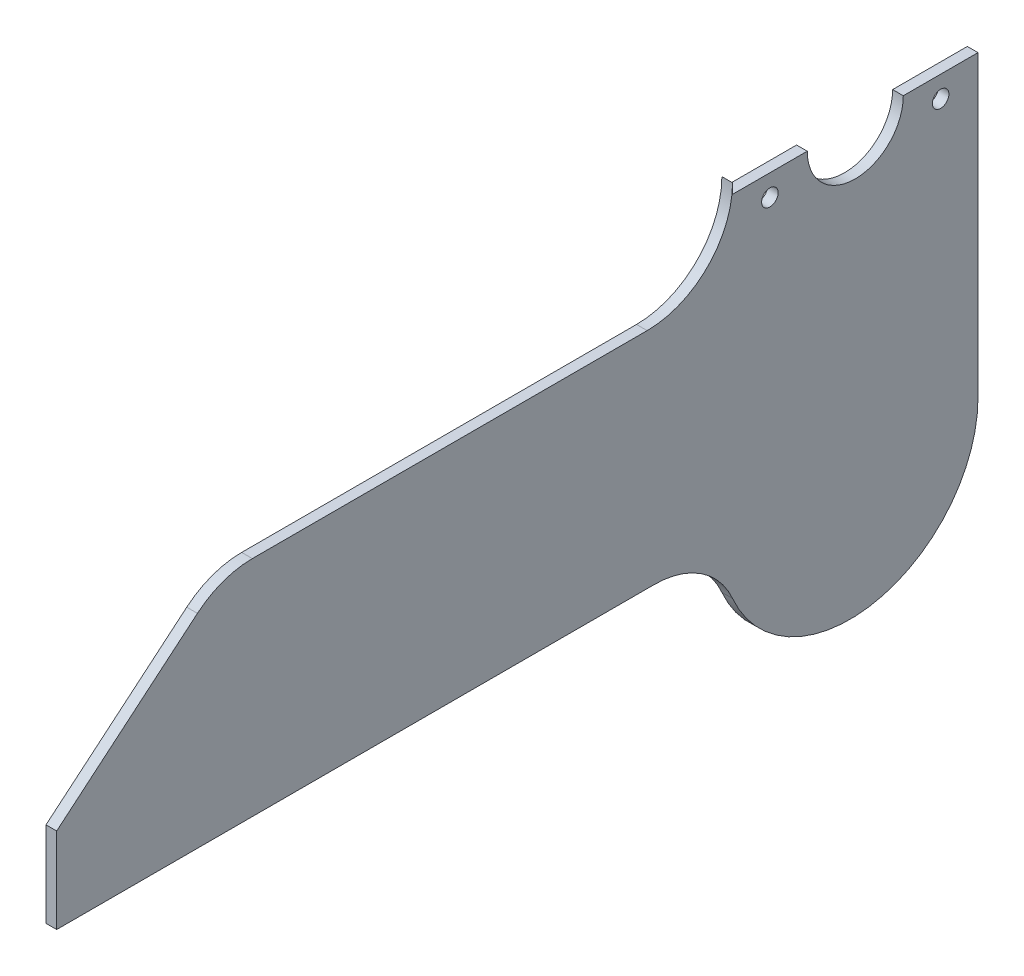
from build123d import *

# Parameters (mm, degrees)
BOSS_EXTRUDE1_DEPTH          = 3.175
F_10_0_1935_DIAMETER_HOLE1_D = 4.9149


with BuildPart() as part:
    # Sketch1 → Boss-Extrude1 (new body)
    with BuildSketch(Plane(origin=(0, 0, 0), x_dir=(0, 0, -1), z_dir=(1, 0, 0))):
        with BuildLine():
            Line((0, -44.45), (0, 44.45))
            Line((0, 44.45), (-22.225, 44.45))
            ThreePointArc((-22.225, 44.45), (-36.5125, 30.1625), (-50.8, 44.45))
            Line((-50.8, 44.45), (-73.025, 44.45))
            Line((-73.025, 44.45), (-73.025, 47.4321837))
            ThreePointArc((-73.025, 47.4321837), (-80.464487758, 29.471671458), (-98.425, 22.0321837))
            Line((-98.425, 22.0321837), (-215.9, 22.0321837))
            ThreePointArc((-215.9, 22.0321837), (-224.58731164, 20.500376268), (-232.226805286, 16.089712555))
            Line((-232.226805286, 16.089712555), (-274.104683967, -19.05))
            Line((-274.104683967, -19.05), (-274.104683967, -44.45))
            Line((-274.104683967, -44.45), (-96.304683967, -44.45))
            ThreePointArc((-96.304683967, -44.45), (-82.392322427, -48.598971875), (-73.025, -59.690456978))
            ThreePointArc((-73.025, -59.690456978), (-30.318441349, -81.74920292), (0, -44.45))
        make_face()
    extrude(amount=BOSS_EXTRUDE1_DEPTH)

    # #10 (0.1935) Diameter Hole1 (through all)
    with Locations(Plane(origin=(3.175, 0, 0), x_dir=(0, 0, -1), z_dir=(1, 0, 0))):
        with Locations((-61.9125, 38.1), (-11.1125, 38.1)):
            Hole(F_10_0_1935_DIAMETER_HOLE1_D / 2)


solid = part.part
